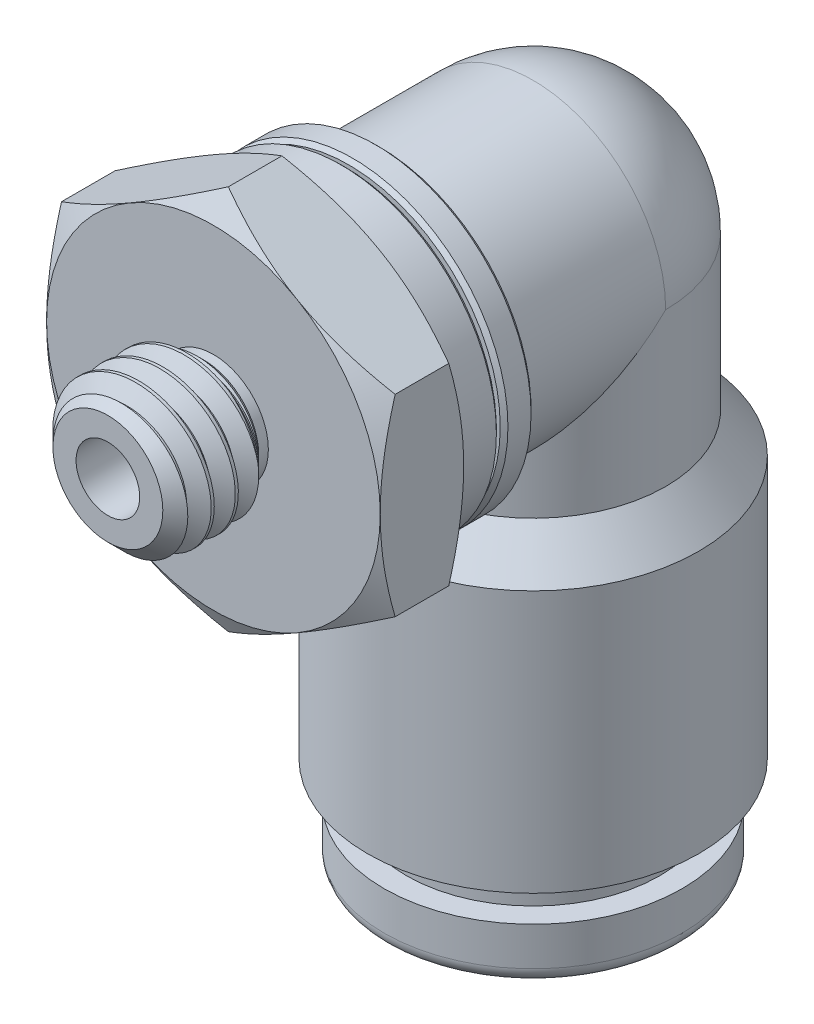
from build123d import *

# Parameters (mm, degrees)
SKETCH1_R          = 2.413
EXTRUDE1_DEPTH     = 3.4798
CUT_SWEEP1_PITCH   = 0.79375
EXTRUDE2_DEPTH     = 2.75
SKETCH6_OUTSIDE_W  = 56.28
SKETCH6_OUTSIDE_H  = 57.982
SKETCH6_OUTSIDE_R  = 5.5
CUT_EXTRUDE1_DEPTH = 11.459146362
CUT_EXTRUDE1_DRAFT = -60
SKETCH7_OUTSIDE_W  = 51.55
SKETCH7_OUTSIDE_H  = 53.252
SKETCH7_OUTSIDE_R  = 5.5
CUT_EXTRUDE2_DEPTH = 10.093532981
CUT_EXTRUDE2_DRAFT = -60
SKETCH23_R         = 4.3688
EXTRUDE3_DEPTH     = 5.0605
REVOLVE3_ANGLE     = 90
CHAMFER1_SIZE      = 0.127
SKETCH18_R         = 1.049518294
CUT_EXTRUDE5_DEPTH = 6.2298
SKETCH32_R         = 3.175
EXTRUDE5_DEPTH     = 6.350853
SKETCH33_R         = 2.54
CUT_EXTRUDE6_DEPTH = 6.350853
CUT_REVOLVE2_ANGLE = 90
SKETCH35_R         = 2.54
CUT_EXTRUDE7_DEPTH = 3.175
SKETCH36_R         = 1.049518294
CUT_EXTRUDE8_DEPTH = 10.8458


# Read off the part's stored shape, not the designer's step: Extrude4
with BuildPart() as part:
    # Sketch1 → Extrude1 (new body)
    with BuildSketch(Plane.XY):
        Circle(SKETCH1_R)
    extrude(amount=-EXTRUDE1_DEPTH)

    # Cut-Sweep1: the profile of Sketch3 screwed along a right-hand helix of 6.944 turns, 6 arcs to a turn; built about Z, then put on its axis
    cut_sweep1_z = Axis((0, 0, 0), (0, 0, 1))
    cut_sweep1_corners = [(2.455962979, 0, -0.719335938), (1.897444252, 0, -0.396875), (1.897444252, 0, -0.29765625), (2.498925958, 0, 0.049609375)]
    with BuildLine(mode=Mode.PRIVATE) as cut_sweep1_profile:
        Line(cut_sweep1_corners[0], cut_sweep1_corners[1])
        Line(cut_sweep1_corners[1], cut_sweep1_corners[2])
        Line(cut_sweep1_corners[2], cut_sweep1_corners[3])
        Line(cut_sweep1_corners[3], cut_sweep1_corners[0])
    cut_sweep1_cap = Face(cut_sweep1_profile.wire())
    cut_sweep1_turn_angles = [0, 30, 60, 90, 120, 150, 180, 210, 240, 270, 300, 330, 360]
    cut_sweep1_turn_weights = [1, 0.8660254037844387, 1, 0.8660254037844387, 1, 0.8660254037844387, 1, 0.8660254037844387, 1, 0.8660254037844387, 1, 0.8660254037844387, 1]
    cut_sweep1_turn_rails = [Edge.make_bspline([Vector(p[0], p[1], 0).rotate(cut_sweep1_z, cut_sweep1_turn_angles[k]) / cut_sweep1_turn_weights[k] + Vector(0, 0, p[2] + CUT_SWEEP1_PITCH * cut_sweep1_turn_angles[k] / 360) for k in range(13)], [0, 0, 0, 1, 1, 2, 2, 3, 3, 4, 4, 5, 5, 6, 6, 6], 2, cut_sweep1_turn_weights) for p in cut_sweep1_corners]
    cut_sweep1_turn_sides = [Face.make_surface_from_curves(cut_sweep1_turn_rails[p[0]], cut_sweep1_turn_rails[p[1]]) for p in [(0, 1), (1, 2), (2, 3), (3, 0)]]
    cut_sweep1_last_angles = [2160, 2190, 2220, 2250, 2280, 2310, 2340, 2370, 2400, 2430, 2460, 2479.92, 2499.84]
    cut_sweep1_last_weights = [1, 0.8660254037844387, 1, 0.8660254037844387, 1, 0.8660254037844387, 1, 0.8660254037844387, 1, 0.8660254037844387, 1, 0.9401692548500417, 1]
    cut_sweep1_last_rails = [Edge.make_bspline([Vector(p[0], p[1], 0).rotate(cut_sweep1_z, cut_sweep1_last_angles[k]) / cut_sweep1_last_weights[k] + Vector(0, 0, p[2] + CUT_SWEEP1_PITCH * cut_sweep1_last_angles[k] / 360) for k in range(13)], [0, 0, 0, 1, 1, 2, 2, 3, 3, 4, 4, 5, 5, 6, 6, 6], 2, cut_sweep1_last_weights) for p in cut_sweep1_corners]
    cut_sweep1_last_sides = [Face.make_surface_from_curves(cut_sweep1_last_rails[p[0]], cut_sweep1_last_rails[p[1]]) for p in [(0, 1), (1, 2), (2, 3), (3, 0)]]
    cut_sweep1 = Plane(origin=(0, 0, 0), x_dir=(0, 1, 0), z_dir=(0, 0, -1)) * Solid(Shell([*[p.moved(Location((0, 0, CUT_SWEEP1_PITCH * i))) for i in range(6) for p in cut_sweep1_turn_sides], *cut_sweep1_last_sides, cut_sweep1_cap, cut_sweep1_cap.rotate(cut_sweep1_z, 2499.84).moved(Location((0, 0, CUT_SWEEP1_PITCH * 2499.84 / 360)))]))
    add(cut_sweep1, mode=Mode.SUBTRACT)

    # Sketch4 → Cut-Revolve1 (revolve, cut)
    with BuildSketch(Plane(origin=(0, 0, 0), x_dir=(0, 0, -1), z_dir=(1, 0, 0)), mode=Mode.PRIVATE) as cut_revolve1_sk:
        Polygon((3.4798, 1.811518294), (3.1623, 1.811518294), (2.474892336, 2.498925958), (3.4798, 2.498925958), align=None)
        Polygon((0.687407664, 2.498925958), (0, 1.811518294), (0, 2.498925958), align=None)
    revolve(cut_revolve1_sk.sketch.rotate(Axis((0, 0, 0), (0, 0, -1)), 90), axis=Axis((0, 0, 0), (0, 0, -1)), mode=Mode.SUBTRACT)

    # Sketch5 → Extrude2 (add)
    with BuildSketch(Plane(origin=(0, 0, -3.4798), x_dir=(-1, 0, 0), z_dir=(0, 0, -1))):
        Polygon((0, 6.350852961), (-5.5, 3.175426481), (-5.5, -3.175426481), (0, -6.350852961), (5.5, -3.175426481), (5.5, 3.175426481), align=None)
    extrude(amount=EXTRUDE2_DEPTH)


with BuildPart() as cut_extrude1_tool:
    # Sketch6 outside → Cut-Extrude1 (with draft: the straight prism first)
    with BuildSketch(Plane(origin=(0, 0, -6.2298), x_dir=(-1, 0, 0), z_dir=(0, 0, -1))):
        Rectangle(SKETCH6_OUTSIDE_W, SKETCH6_OUTSIDE_H)
        Circle(SKETCH6_OUTSIDE_R, mode=Mode.SUBTRACT)
    extrude(amount=-CUT_EXTRUDE1_DEPTH)
    # Cut-Extrude1: the draft: its side faces are tilted about the plane it starts from
    cut_extrude1_sides = [cut_extrude1_tool.faces().sort_by_distance(p)[0] for p in [
        (0, -28.991, -0.500226819),
        (-28.14, 0, -0.500226819),
        (0, 28.991, -0.500226819),
        (28.14, 0, -0.500226819),
        (5.5, 0, -0.500226819),
    ]]
    draft(cut_extrude1_sides, Plane(origin=(0, 0, -6.2298), x_dir=(-1, 0, 0), z_dir=(0, 0, -1)), CUT_EXTRUDE1_DRAFT)


with BuildPart() as part_1:
    add(part.part)

    # Cut-Extrude1: cut by cut_extrude1_tool
    add(cut_extrude1_tool.part, mode=Mode.SUBTRACT)


with BuildPart() as cut_extrude2_tool:
    # Sketch7 outside → Cut-Extrude2 (with draft: the straight prism first)
    with BuildSketch(Plane.XY.offset(-3.4798)):
        Rectangle(SKETCH7_OUTSIDE_W, SKETCH7_OUTSIDE_H)
        Circle(SKETCH7_OUTSIDE_R, mode=Mode.SUBTRACT)
    extrude(amount=-CUT_EXTRUDE2_DEPTH)
    # Cut-Extrude2: the draft: its side faces are tilted about the plane it starts from
    cut_extrude2_sides = [cut_extrude2_tool.faces().sort_by_distance(p)[0] for p in [
        (0, -26.626, -8.52656649),
        (25.775, 0, -8.52656649),
        (0, 26.626, -8.52656649),
        (-25.775, 0, -8.52656649),
        (-5.5, 0, -8.52656649),
    ]]
    draft(cut_extrude2_sides, Plane.XY.offset(-3.4798), CUT_EXTRUDE2_DRAFT)


with BuildPart() as part_2:
    add(part_1.part)

    # Cut-Extrude2: cut by cut_extrude2_tool
    add(cut_extrude2_tool.part, mode=Mode.SUBTRACT)

    # Sketch11 → Revolve2 (revolve)
    with BuildSketch(Plane(origin=(0, 0, 0), x_dir=(0, 0, -1), z_dir=(1, 0, 0)), mode=Mode.PRIVATE) as revolve2_sk:
        Polygon((6.2298, -5.119), (7.8173, -5.119), (7.8173, -3.976), (7.9443, -3.976), (7.9443, -5.119), (8.9603, -5.119), (8.9603, 0), (6.2298, 0), align=None)
    revolve(revolve2_sk.sketch.rotate(Axis((0, 0, 0), (0, 0, -1)), 270), axis=Axis((0, 0, 0), (0, 0, -1)))

    # Sketch23 → Extrude3 (add)
    with BuildSketch(Plane(origin=(0, 0, -8.9603), x_dir=(-1, 0, 0), z_dir=(0, 0, -1))):
        Circle(SKETCH23_R)
    extrude(amount=EXTRUDE3_DEPTH)



with BuildPart() as body_2:
    # Sketch10 → Revolve1 (revolve)
    with BuildSketch(Plane(origin=(0, 0, 0), x_dir=(0, 0, -1), z_dir=(1, 0, 0))):
        with BuildLine():
            Line((9.6139, -18.034), (10.4648, -18.034))
            Line((10.4648, -18.034), (10.8458, -17.653))
            Line((10.8458, -17.653), (10.8458, -3.626504248))
            Line((10.8458, -3.626504248), (8.5598, -6.350852961))
            Line((8.5598, -6.350852961), (8.5598, -14.986))
            Line((8.5598, -14.986), (9.843135, -14.986))
            Line((9.843135, -14.986), (9.843135, -16.256))
            Line((9.843135, -16.256), (9.1059, -16.256))
            Line((9.1059, -16.256), (9.1059, -17.526))
            ThreePointArc((9.1059, -17.526), (9.254689755, -17.885210245), (9.6139, -18.034))
        make_face()
    revolve(axis=Axis((0, 0, -14.0208), (0, -1, 0)))


with BuildPart() as part_3:
    add(part_2.part)

    add(body_2.part)  # Extrude4 merges body 2
    # Extrude4 outline → Extrude4 (revolve)
    with BuildSketch(Plane.XY.offset(-14.0208)):
        Polygon((3.175001776, -5.049219687), (4.3688, -5.049219687), (4.3688, 0), (0.132001623, 0), (3.175001776, -3.626506366), align=None)
    revolve(axis=Axis((0, 0, -14.0208), (0, 1, 0)))

    # Sketch31 → Revolve3 (revolve)
    with BuildSketch(Plane(origin=(0, 0, -14.0208), x_dir=(-1, 0, 0), z_dir=(0, 0, -1))):
        with BuildLine():
            Line((-4.3688, 0), (4.3688, 0))
            ThreePointArc((4.3688, 0), (0, 4.3688), (-4.3688, 0))
        make_face()
    revolve(axis=Axis((4.3688, 0, -14.0208), (-1, 0, 0)), revolution_arc=REVOLVE3_ANGLE)

    # Chamfer1
    chamfer1_edges = [part_3.edges().sort_by_distance(p)[0] for p in [
        (-5.119, 0, -8.9603),
        (-5.119, 0, -7.9443),
        (-5.119, 0, -7.8173),
    ]]
    chamfer(chamfer1_edges, length=CHAMFER1_SIZE)

    # Sketch18 → Cut-Extrude5 (cut)
    with BuildSketch(Plane.XY):
        Circle(SKETCH18_R)
    extrude(amount=-CUT_EXTRUDE5_DEPTH, mode=Mode.SUBTRACT)

    # Sketch32 → Extrude5 (add)
    with BuildSketch(Plane(origin=(0, 0, 0), x_dir=(1, 0, 0), z_dir=(0, 1, 0))):
        with Locations(Location((0, 14.0208, 0), (0, 0, 270))):
            Circle(SKETCH32_R)
    extrude(amount=-EXTRUDE5_DEPTH)

    # Sketch33 → Cut-Extrude6 (cut)
    with BuildSketch(Plane.XZ.offset(6.350852961)):
        with Locations(Location((0, -14.0208, 0), (0, 0, 270))):
            Circle(SKETCH33_R)
    extrude(amount=-CUT_EXTRUDE6_DEPTH, mode=Mode.SUBTRACT)

    # Sketch34 → Cut-Revolve2 (revolve, cut)
    with BuildSketch(Plane.XZ):
        with BuildLine():
            Line((-2.54, -14.0208), (2.54, -14.0208))
            ThreePointArc((2.54, -14.0208), (0, -16.5608), (-2.54, -14.0208))
        make_face()
    revolve(axis=Axis((2.54, 0, -14.0208), (1, 0, 0)), revolution_arc=CUT_REVOLVE2_ANGLE, mode=Mode.SUBTRACT)

    # Sketch35 → Cut-Extrude7 (cut)
    with BuildSketch(Plane(origin=(0, 0, -14.0208), x_dir=(-1, 0, 0), z_dir=(0, 0, -1))):
        with Locations(Location((0, 0, 0), (0, 0, 90))):
            Circle(SKETCH35_R)
    extrude(amount=-CUT_EXTRUDE7_DEPTH, mode=Mode.SUBTRACT)

    # Sketch36 → Cut-Extrude8 (cut)
    with BuildSketch(Plane.XY):
        Circle(SKETCH36_R)
    extrude(amount=-CUT_EXTRUDE8_DEPTH, mode=Mode.SUBTRACT)


solid = part_3.part
